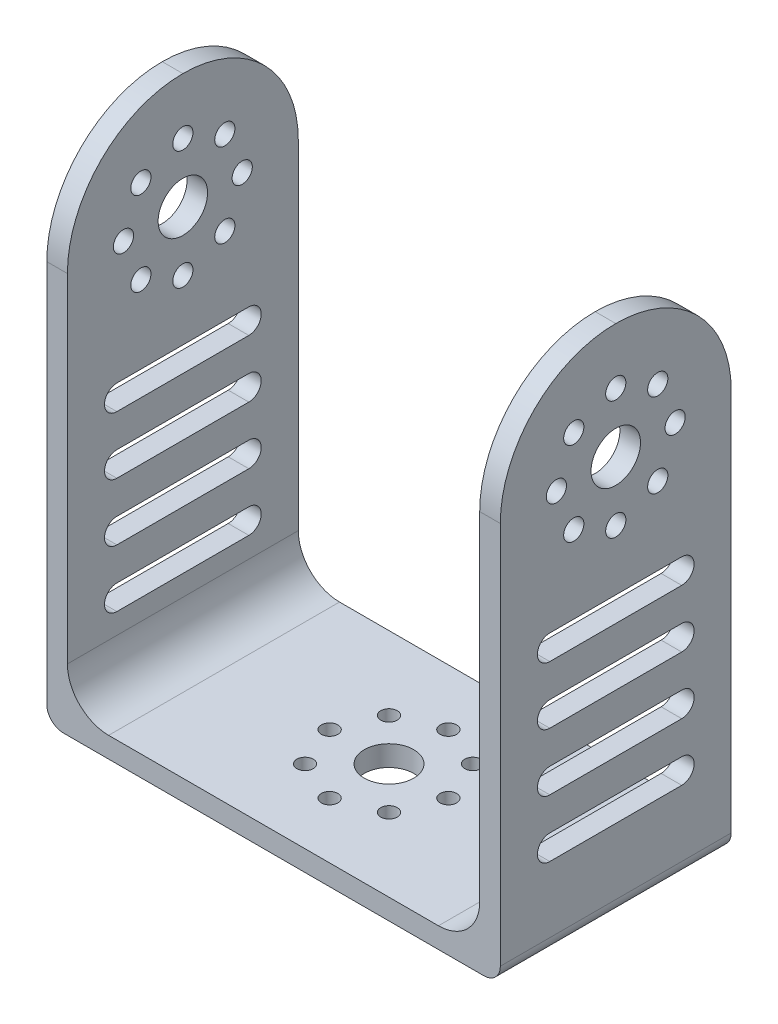
from build123d import *

# Parameters (mm, degrees)
ESQUISSE1_W             = 55
ESQUISSE1_H             = 28
ESQUISSE1_R             = 1
ESQUISSE1_R_2           = 3
BOSS_EXTRU_1_DEPTH      = 2.5
ESQUISSE2_W             = 2.5
ESQUISSE2_H             = 28
BOSS_EXTRU_2_DEPTH      = 60
CONG_1_R                = 5
CONG_2_R                = 2
ESQUISSE3_R             = 1.224893227
ESQUISSE3_R_2           = 3
ENL_V_MAT_EXTRU_1_DEPTH = 55
CONG_3_R                = 14


with BuildPart() as part:
    # Esquisse1 → Boss.-Extru.1 (new body)
    with BuildSketch(Plane(origin=(0, 0, 0), x_dir=(1, 0, 0), z_dir=(0, 1, 0))):
        with Locations((27.5, 14)):
            Rectangle(ESQUISSE1_W, ESQUISSE1_H)
        with Locations(Location((22.408831175, 19.091168825, 0), (0, 0, 270))):
            Circle(ESQUISSE1_R, mode=Mode.SUBTRACT)
        with Locations(Location((27.5, 21.2, 0), (0, 0, 270))):
            Circle(ESQUISSE1_R, mode=Mode.SUBTRACT)
        with Locations(Location((32.591168825, 19.091168825, 0), (0, 0, 270))):
            Circle(ESQUISSE1_R, mode=Mode.SUBTRACT)
        with Locations(Location((34.7, 14, 0), (0, 0, 270))):
            Circle(ESQUISSE1_R, mode=Mode.SUBTRACT)
        with Locations(Location((32.591168825, 8.908831175, 0), (0, 0, 270))):
            Circle(ESQUISSE1_R, mode=Mode.SUBTRACT)
        with Locations(Location((27.5, 6.8, 0), (0, 0, 270))):
            Circle(ESQUISSE1_R, mode=Mode.SUBTRACT)
        with Locations(Location((22.408831175, 8.908831175, 0), (0, 0, 270))):
            Circle(ESQUISSE1_R, mode=Mode.SUBTRACT)
        with Locations(Location((20.3, 14, 0), (0, 0, 270))):
            Circle(ESQUISSE1_R, mode=Mode.SUBTRACT)
        with Locations(Location((27.5, 14, 0), (0, 0, 270))):
            Circle(ESQUISSE1_R_2, mode=Mode.SUBTRACT)
    extrude(amount=BOSS_EXTRU_1_DEPTH)

    # Esquisse2 → Boss.-Extru.2 (add)
    with BuildSketch(Plane(origin=(0, 2.5, 0), x_dir=(1, 0, 0), z_dir=(0, 1, 0))):
        with Locations((1.25, 14)):
            Rectangle(ESQUISSE2_W, ESQUISSE2_H)
        with Locations((53.75, 14)):
            Rectangle(ESQUISSE2_W, ESQUISSE2_H)
    extrude(amount=BOSS_EXTRU_2_DEPTH)

    # Congé1
    cong_1_edges = [part.edges().sort_by_distance(p)[0] for p in [
        (2.5, 2.5, -14),
        (52.5, 2.5, -14),
    ]]
    fillet(cong_1_edges, radius=CONG_1_R)

    # Congé2
    cong_2_edges = [part.edges().sort_by_distance(p)[0] for p in [
        (55, 0, -14),
        (0, 0, -14),
    ]]
    fillet(cong_2_edges, radius=CONG_2_R)

    # Esquisse3 → Enlèv. mat.-Extru.1 (cut)
    with BuildSketch(Plane(origin=(55, 0, 0), x_dir=(0, 0, -1), z_dir=(1, 0, 0))):
        with Locations((14, 41.3)):
            Circle(ESQUISSE3_R)
        with Locations((8.908831175, 43.408831175)):
            Circle(ESQUISSE3_R)
        with Locations((6.8, 48.5)):
            Circle(ESQUISSE3_R)
        with Locations((8.908831175, 53.591168825)):
            Circle(ESQUISSE3_R)
        with Locations((14, 55.7)):
            Circle(ESQUISSE3_R)
        with Locations((19.091168825, 53.591168825)):
            Circle(ESQUISSE3_R)
        with Locations((21.2, 48.5)):
            Circle(ESQUISSE3_R)
        with Locations((19.091168825, 43.408831175)):
            Circle(ESQUISSE3_R)
        with Locations((14, 48.5)):
            Circle(ESQUISSE3_R_2)
        with BuildLine():
            Line((22, 10), (6, 10))
            ThreePointArc((6, 10), (4.5, 11.5), (6, 13))
            Line((6, 13), (22, 13))
            ThreePointArc((22, 13), (23.5, 11.5), (22, 10))
        make_face()
        with BuildLine():
            Line((22, 17), (6, 17))
            ThreePointArc((6, 17), (4.5, 18.5), (6, 20))
            Line((6, 20), (22, 20))
            ThreePointArc((22, 20), (23.5, 18.5), (22, 17))
        make_face()
        with BuildLine():
            Line((22, 24), (6, 24))
            ThreePointArc((6, 24), (4.5, 25.5), (6, 27))
            Line((6, 27), (22, 27))
            ThreePointArc((22, 27), (23.5, 25.5), (22, 24))
        make_face()
        with BuildLine():
            Line((22, 31), (6, 31))
            ThreePointArc((6, 31), (4.5, 32.5), (6, 34))
            Line((6, 34), (22, 34))
            ThreePointArc((22, 34), (23.5, 32.5), (22, 31))
        make_face()
    extrude(amount=-ENL_V_MAT_EXTRU_1_DEPTH, mode=Mode.SUBTRACT)

    # Congé3
    cong_3_edges = [part.edges().sort_by_distance(p)[0] for p in [
        (1.25, 62.5, 0),
        (53.75, 62.5, -28),
        (53.75, 62.5, 0),
        (1.25, 62.5, -28),
    ]]
    fillet(cong_3_edges, radius=CONG_3_R - 0.0001)  # a hair under: the kernel refuses the full size


solid = part.part
